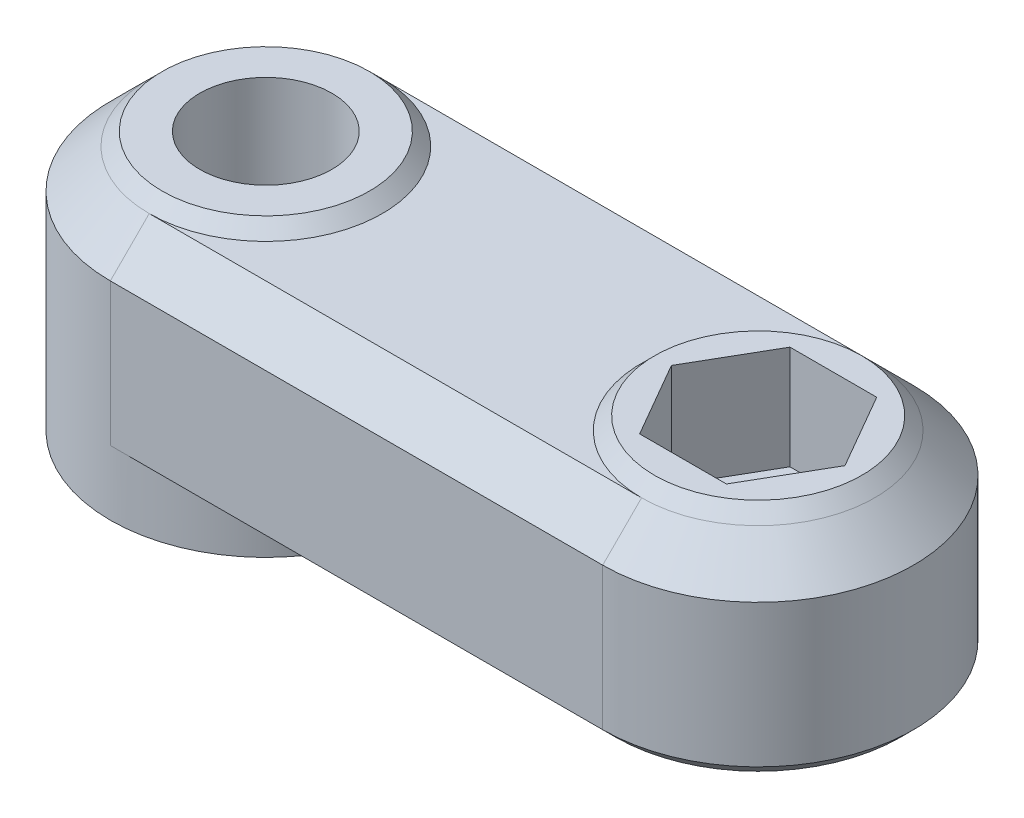
from build123d import *

# Parameters (mm, degrees)
BOSS_EXTRUDE1_DEPTH = 10
CHAMFER1_SIZE       = 2
CUT_EXTRUDE1_DEPTH  = 5
SKETCH5_R           = 34.202431596
SKETCH5_R_2         = 6
CUT_EXTRUDE2_DEPTH  = 2
CUT_EXTRUDE3_DEPTH  = 4
CHAMFER2_SIZE       = 0.5
SKETCH7_W           = 40.92273168
SKETCH7_H           = 22.154300558
SKETCH7_R           = 4
CUT_EXTRUDE4_DEPTH  = 0.5
CHAMFER3_SIZE       = 0.5


# Some blends are built 0.0001 mm under size
with BuildPart() as part:
    # Sketch1 → Boss-Extrude1 (new body)
    with BuildSketch(Plane(origin=(0, 0, 0), x_dir=(1, 0, 0), z_dir=(0, 1, 0))):
        with BuildLine():
            Line((0, 6), (19, 6))
            ThreePointArc((19, 6), (25, 0), (19, -6))
            Line((19, -6), (0, -6))
            ThreePointArc((0, -6), (-6, 0), (0, 6))
        make_face()
    extrude(amount=BOSS_EXTRUDE1_DEPTH)

    # Sketch2 → Cut-Revolve1 (revolve, cut)
    with BuildSketch(Plane.XY, mode=Mode.PRIVATE) as cut_revolve1_sk:
        Polygon((0, 10), (-2.55, 10), (-2.55, 5), (-2.1, 5), (-2.1, 2), (-2.55, 2), (-2.55, 0), (0, 0), align=None)
    revolve(cut_revolve1_sk.sketch.rotate(Axis((0, 0, 0), (0, 1, 0)), 270), axis=Axis((0, 0, 0), (0, 1, 0)), mode=Mode.SUBTRACT)

    # Sketch3 → Cut-Revolve2 (revolve, cut)
    with BuildSketch(Plane.XY, mode=Mode.PRIVATE) as cut_revolve2_sk:
        Polygon((19, 10), (16.5, 10), (16.5, 6), (16.925, 6), (16.925, 0), (19, 0), align=None)
    revolve(cut_revolve2_sk.sketch.rotate(Axis((19, 0, 0), (0, 1, 0)), 270), axis=Axis((19, 0, 0), (0, 1, 0)), mode=Mode.SUBTRACT)

    # Chamfer1
    chamfer1_edges = [part.edges().sort_by_distance(p)[0] for p in [
        (25, 10, 0),
        (9.5, 10, -6),
        (-6, 10, 0),
        (9.5, 10, 6),
    ]]
    chamfer(chamfer1_edges, length=CHAMFER1_SIZE)

    # Sketch4 → Cut-Extrude1 (cut)
    with BuildSketch(Plane.XZ):
        Polygon((2.107328483, 3.65), (-2.107328483, 3.65), (-4.214656965, 0), (-2.107328483, -3.65), (2.107328483, -3.65), (4.214656965, 0), align=None)
    extrude(amount=-CUT_EXTRUDE1_DEPTH, mode=Mode.SUBTRACT)

    # Sketch5 → Cut-Extrude2 (cut)
    with BuildSketch(Plane.XZ):
        Circle(SKETCH5_R)
        with Locations(Location((0, 0, 0), (0, 0, 90))):
            Circle(SKETCH5_R_2, mode=Mode.SUBTRACT)
    extrude(amount=-CUT_EXTRUDE2_DEPTH, mode=Mode.SUBTRACT)

    # Sketch6 → Cut-Extrude3 (cut)
    with BuildSketch(Plane(origin=(0, 10, 0), x_dir=(1, 0, 0), z_dir=(0, 1, 0))):
        Polygon((20.674315781, -2.9), (22.348631561, 0), (20.674315781, 2.9), (17.325684219, 2.9), (15.651368439, 0), (17.325684219, -2.9), align=None)
    extrude(amount=-CUT_EXTRUDE3_DEPTH, mode=Mode.SUBTRACT)

    # Chamfer2
    # the kernel refuses this chamfer: 0.5 mm, written as the material it takes off along each edge
    with BuildSketch(Plane(origin=(19, 2, 0), x_dir=(0, 0, -1), z_dir=(-1, 0, 0))) as chamfer2_piece_1:
        Polygon((6 - CHAMFER2_SIZE, 0), (6, -CHAMFER2_SIZE), (6, 0), align=None)
    revolve(axis=Axis((19, 2, 0), (0, -1, 0)), revolution_arc=180, mode=Mode.SUBTRACT)
    with BuildSketch(Plane(origin=(-1.285841494, 2, 6), x_dir=(0, -0.02749587661058651, -0.9996219169112968), z_dir=(1, 0, 0))) as chamfer2_piece_2_section:
        Polygon((CHAMFER2_SIZE * 0.999621916911, CHAMFER2_SIZE * 0.0274958766106), (-CHAMFER2_SIZE * 0.0274958766106, CHAMFER2_SIZE * 0.999621916911), (0, 0), align=None)
    chamfer2_piece_2 = extrude(amount=20.285841494, mode=Mode.PRIVATE)
    chamfer2_piece_2 = chamfer2_piece_2 - Plane(origin=(0, 2.170377839, 0), x_dir=(0, 0, 1), z_dir=(0, -1, 0)) * Cylinder(6, 43, mode=Mode.PRIVATE)
    add(chamfer2_piece_2, mode=Mode.SUBTRACT)
    with BuildSketch(Plane(origin=(19, 2, -6), x_dir=(0, 0.9996219169112968, -0.027495876610585623), z_dir=(-1, 0, 0))) as chamfer2_piece_3_section:
        Polygon((CHAMFER2_SIZE * 0.999621916911, -CHAMFER2_SIZE * 0.0274958766106), (-CHAMFER2_SIZE * 0.0274958766106, -CHAMFER2_SIZE * 0.999621916911), (0, 0), align=None)
    chamfer2_piece_3 = extrude(amount=20.285841494, mode=Mode.PRIVATE)
    chamfer2_piece_3 = chamfer2_piece_3 - Plane(origin=(0, 2.17037784, 0), x_dir=(0, 0, 1), z_dir=(0, -1, 0)) * Cylinder(6, 43, mode=Mode.PRIVATE)
    add(chamfer2_piece_3, mode=Mode.SUBTRACT)

    # Sketch7 → Cut-Extrude4 (cut)
    with BuildSketch(Plane(origin=(0, 10, 0), x_dir=(1, 0, 0), z_dir=(0, 1, 0))):
        with Locations((9.45107525, -1.501135351)):
            Rectangle(SKETCH7_W, SKETCH7_H)
        with Locations(Location((19, 0, 0), (0, 0, 270))):
            Circle(SKETCH7_R, mode=Mode.SUBTRACT)
        with Locations(Location((0, 0, 0), (0, 0, 270))):
            Circle(SKETCH7_R, mode=Mode.SUBTRACT)
    extrude(amount=-CUT_EXTRUDE4_DEPTH, mode=Mode.SUBTRACT)

    # Chamfer3
    chamfer3_edges = [part.edges().sort_by_distance(p)[0] for p in [
        (0, 9.5, -4),
        (19, 9.5, -4),
    ]]
    chamfer(chamfer3_edges, length=CHAMFER3_SIZE - 0.0001)  # a hair under: the kernel refuses the full size


solid = part.part
